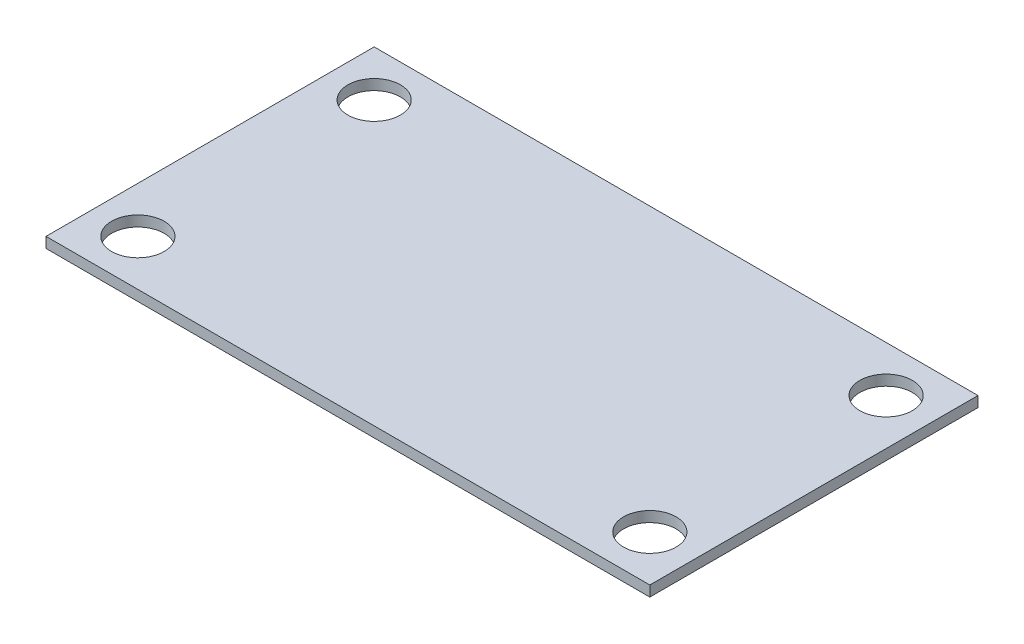
from build123d import *

# Parameters (mm, degrees)
SKETCH_1_W      = 92
SKETCH_1_H      = 50
SKETCH_1_R      = 4
EXTRUDE_1_DEPTH = 1.6


with BuildPart() as part:
    # 草图1 → 凸台-拉伸1 (new body)
    with BuildSketch(Plane(origin=(0, 0, 0), x_dir=(1, 0, 0), z_dir=(0, 1, 0))):
        Rectangle(SKETCH_1_W, SKETCH_1_H)
        with Locations((-39, -18)):
            Circle(SKETCH_1_R, mode=Mode.SUBTRACT)
        with Locations((39, -18)):
            Circle(SKETCH_1_R, mode=Mode.SUBTRACT)
        with Locations((39, 18)):
            Circle(SKETCH_1_R, mode=Mode.SUBTRACT)
        with Locations((-39, 18)):
            Circle(SKETCH_1_R, mode=Mode.SUBTRACT)
    extrude(amount=EXTRUDE_1_DEPTH)


solid = part.part
